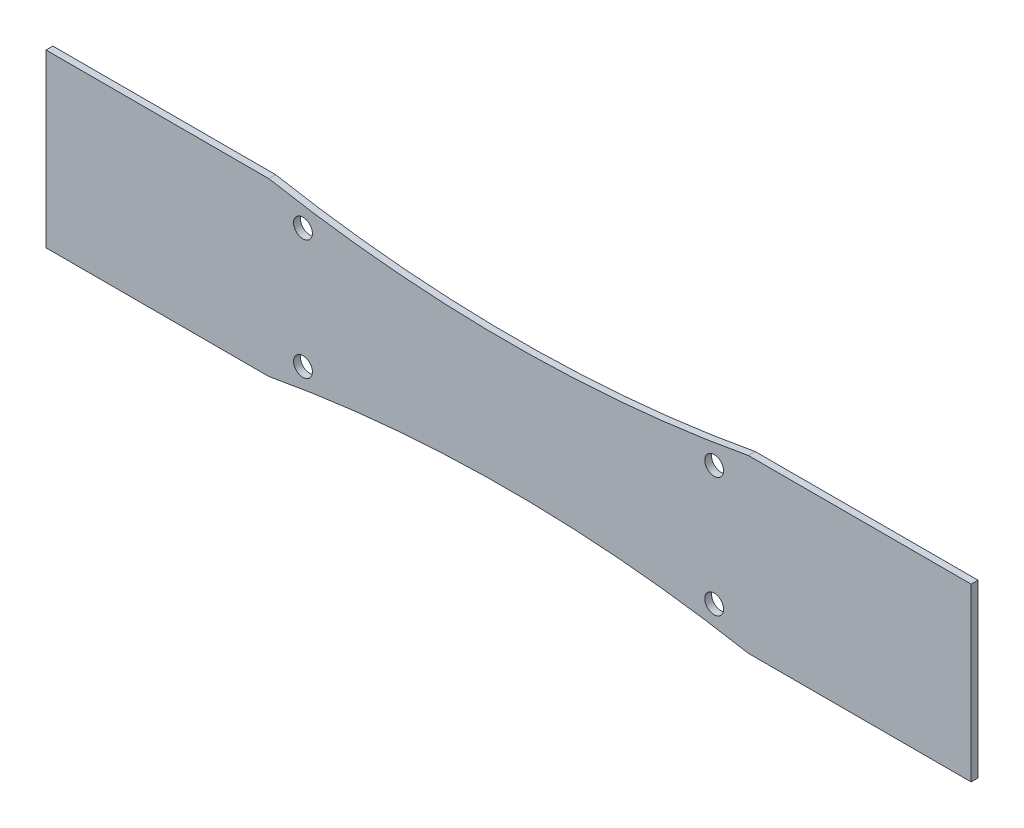
from build123d import *

# Parameters (mm, degrees)
BOSS_EXTRUDE1_DEPTH  = 2
M5_CLEARANCE_HOLE1_D = 5.5


with BuildPart() as part:
    # Sketch1 → Boss-Extrude1 (new body)
    with BuildSketch(Plane.XY):
        with BuildLine():
            Line((135, -25), (70, -25))
            ThreePointArc((70, -25), (0, -18.588501155), (-70, -25))
            Line((-70, -25), (-135, -25))
            Line((-135, -25), (-135, 25))
            Line((-135, 25), (-70, 25))
            ThreePointArc((-70, 25), (0, 18.588501155), (70, 25))
            Line((70, 25), (135, 25))
            Line((135, 25), (135, -25))
        make_face()
    extrude(amount=BOSS_EXTRUDE1_DEPTH)

    # M5 Clearance Hole1 (through all)
    with Locations(Plane(origin=(-60, 17.5, 2), x_dir=(1, 0, 0), z_dir=(0, 0, 1))):
        with Locations((0, 0), (0, -35), (120, 0), (120, -35)):
            Hole(M5_CLEARANCE_HOLE1_D / 2)


solid = part.part
